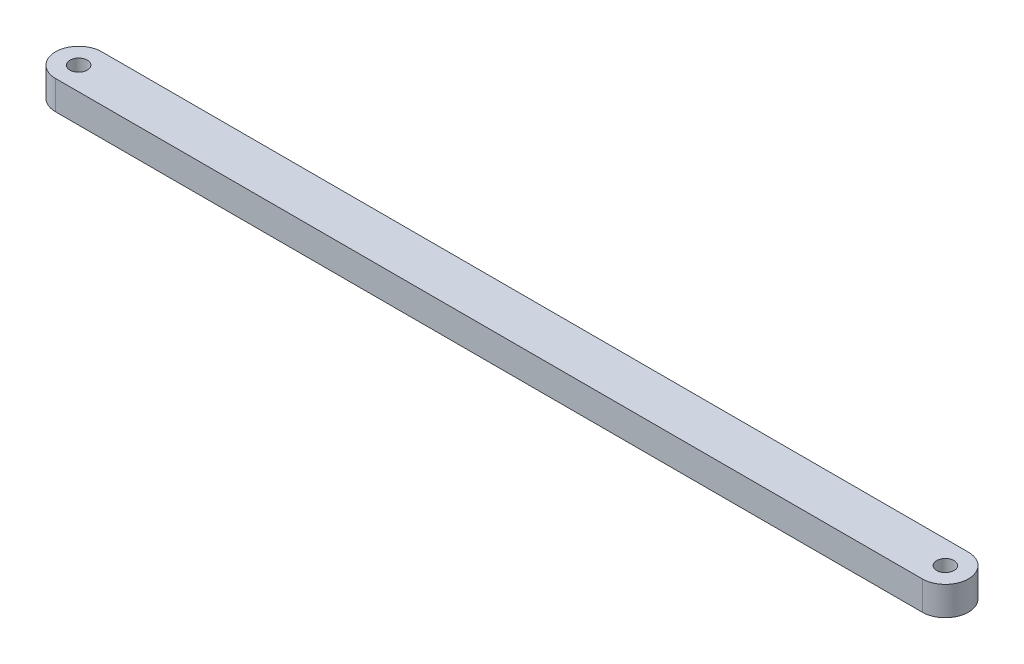
from build123d import *

# Parameters (mm, degrees)
SKETCH1_R           = 1.5
BOSS_EXTRUDE1_DEPTH = 5


with BuildPart() as part:
    # Sketch1 → Boss-Extrude1 (new body)
    with BuildSketch(Plane(origin=(0, 0, 0), x_dir=(1, 0, 0), z_dir=(0, 1, 0))):
        with BuildLine():
            Line((-75, 4), (75, 4))
            ThreePointArc((75, 4), (79, 0), (75, -4))
            Line((75, -4), (-75, -4))
            ThreePointArc((-75, -4), (-79, 0), (-75, 4))
        make_face()
        with Locations((-75, 0)):
            Circle(SKETCH1_R, mode=Mode.SUBTRACT)
        with Locations((75, 0)):
            Circle(SKETCH1_R, mode=Mode.SUBTRACT)
    extrude(amount=BOSS_EXTRUDE1_DEPTH)


solid = part.part
